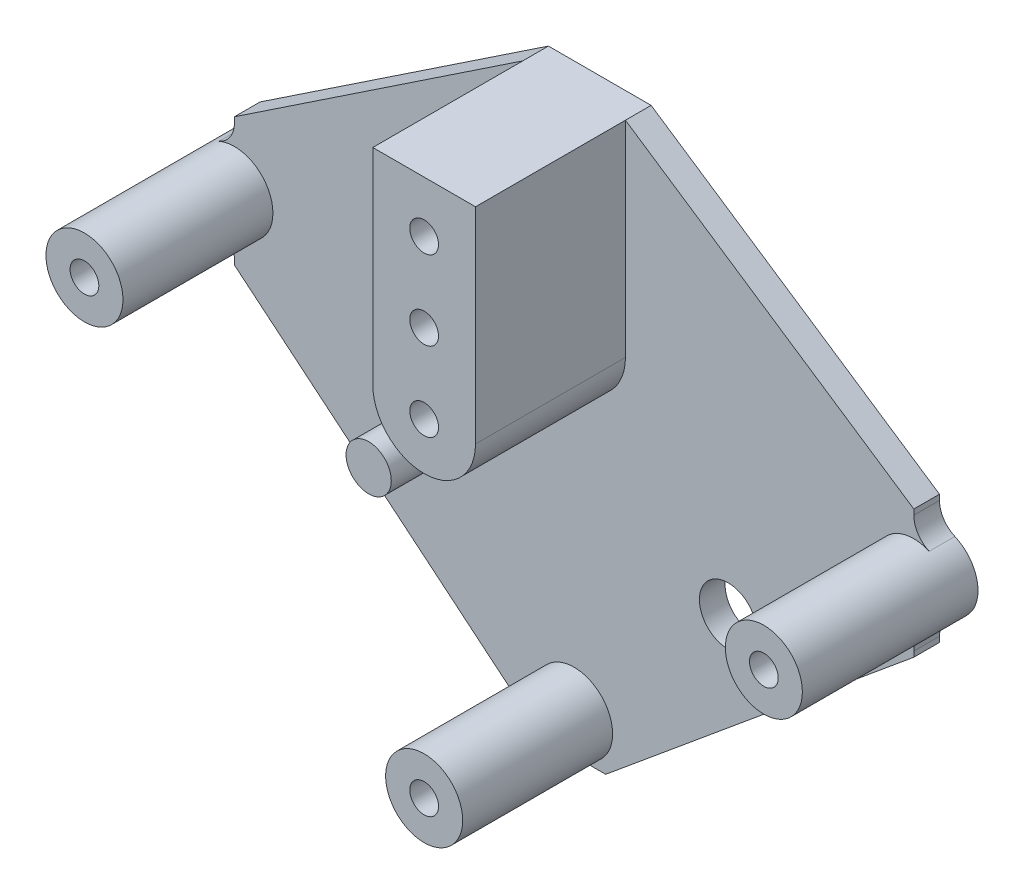
from build123d import *

# Parameters (mm, degrees)
SKETCH1_W               = 84.00796
SKETCH1_H               = 71.2724
BOSS_EXTRUDE1_DEPTH     = 3.175
SKETCH5_R               = 4.7625
BOSS_EXTRUDE3_DEPTH     = 3.175
SKETCH3_R               = 1.8415
CUT_EXTRUDE1_DEPTH      = 114.886040389
BOSS_EXTRUDE4_START     = 18.542
SKETCH6_R               = 4.7625
BOSS_EXTRUDE4_DEPTH     = 18.542
CUT_EXTRUDE2_DEPTH      = 116.341906237
CUT_EXTRUDE2_DEPTH_BACK = 116.341906237
SKETCH4_R               = 1.778
SKETCH7_R               = 1.778
CUT_EXTRUDE3_DEPTH      = 116.894683482
SKETCH8_R               = 3.556
SKETCH8_R_2             = 1.905
CUT_EXTRUDE4_DEPTH      = 116.894683482
CUT_EXTRUDE5_DEPTH      = 116.894683482
FILLET1_R               = 3.175
SKETCH10_R              = 2.794
BOSS_EXTRUDE5_DEPTH     = 6.35
BOSS_EXTRUDE6_START     = 3.175
SKETCH11_R              = 1.905
BOSS_EXTRUDE6_DEPTH     = 3.175


with BuildPart() as part:
    # Sketch1 → Boss-Extrude1 (new body)
    with BuildSketch(Plane.XY):
        with Locations((42.00398, 35.6362)):
            Rectangle(SKETCH1_W, SKETCH1_H)
    extrude(amount=BOSS_EXTRUDE1_DEPTH)

    # Sketch5 → Boss-Extrude3 (add)
    with BuildSketch(Plane.XY.offset(3.175)):
        with Locations((84.00796, 39.524999944)):
            Circle(SKETCH5_R)
        with Locations((0, 39.524999944)):
            Circle(SKETCH5_R)
    extrude(amount=-BOSS_EXTRUDE3_DEPTH)

    # Sketch3 → Cut-Extrude1 (cut, through all)
    with BuildSketch(Plane.XY.offset(3.175)):
        with Locations((42.00398, 4.7625)):
            Circle(SKETCH3_R)
    extrude(amount=-CUT_EXTRUDE1_DEPTH, mode=Mode.SUBTRACT)

    # Sketch6 → Boss-Extrude4 (add)
    with BuildSketch(Plane.XY.offset(3.175).offset(BOSS_EXTRUDE4_START)):
        with Locations((84.00796, 39.524999944)):
            Circle(SKETCH6_R)
        with Locations((0, 39.524999944)):
            Circle(SKETCH6_R)
        with Locations(Location((42.00398, 4.7625, 0), (0, 0, 270))):
            Circle(SKETCH6_R)
        with BuildLine():
            Line((35.65398, 71.2724), (48.35398, 71.2724))
            Line((48.35398, 71.2724), (48.35398, 45.8724))
            ThreePointArc((48.35398, 45.8724), (42.00398, 39.5224), (35.65398, 45.8724))
            Line((35.65398, 45.8724), (35.65398, 71.2724))
        make_face()
    extrude(amount=-BOSS_EXTRUDE4_DEPTH)

    # Sketch4 → Cut-Extrude2 (cut, two sides: drawn at the far end of the back side and taken through both)
    with BuildSketch(Plane.XY.offset(3.175).offset(-CUT_EXTRUDE2_DEPTH_BACK)):
        with Locations((42.00398, 64.9224)):
            Circle(SKETCH4_R)
        with Locations((42.00398, 55.1434)):
            Circle(SKETCH4_R)
        with Locations((42.00398, 45.3644)):
            Circle(SKETCH4_R)
    extrude(amount=CUT_EXTRUDE2_DEPTH + CUT_EXTRUDE2_DEPTH_BACK, mode=Mode.SUBTRACT)

    # Sketch7 → Cut-Extrude3 (cut, through all)
    with BuildSketch(Plane(origin=(0, 0, 0), x_dir=(-1, 0, 0), z_dir=(0, 0, -1))):
        with Locations((-42.00398, 4.7625)):
            Circle(SKETCH7_R)
        with Locations((0, 39.524999944)):
            Circle(SKETCH7_R)
        with Locations((-84.00796, 39.524999944)):
            Circle(SKETCH7_R)
    extrude(amount=-CUT_EXTRUDE3_DEPTH, mode=Mode.SUBTRACT)

    # Sketch8 → Cut-Extrude4 (cut, through all)
    with BuildSketch(Plane(origin=(0, 0, 0), x_dir=(-1, 0, 0), z_dir=(0, 0, -1))):
        with Locations((-61.05398, 24.524999972)):
            Circle(SKETCH8_R)
        with Locations((-22.95398, 24.524999972)):
            Circle(SKETCH8_R_2)
    extrude(amount=-CUT_EXTRUDE4_DEPTH, mode=Mode.SUBTRACT)

    # Sketch9 → Cut-Extrude5 (cut, through all)
    with BuildSketch(Plane(origin=(0, 0, 0), x_dir=(-1, 0, 0), z_dir=(0, 0, -1))):
        Polygon((-84.00796, 0), (-84.00796, 31.587499944), (-45.90796, 0), align=None)
        Polygon((-84.00796, 71.2724), (-84.00796, 47.462499944), (-48.35398, 71.2724), align=None)
    cut_extrude5 = extrude(amount=-CUT_EXTRUDE5_DEPTH, mode=Mode.SUBTRACT)

    # Mirror1: Cut-Extrude5 across plane
    add(cut_extrude5.mirror(Plane(origin=(42.00398, 0, 0), x_dir=(0, 0, 1), z_dir=(1, 0, 0))), mode=Mode.SUBTRACT)

    # Fillet1
    # the kernel refuses this fillet: 3.175 mm, written as the material it adds along each edge
    with BuildSketch(Plane(origin=(84.00796, 34.762499944, 0), x_dir=(0.9789063129307042, 0.2043096436892158, 0), z_dir=(0, 0, 1))) as fillet1_piece_1:
        with BuildLine():
            CenterArc((2.594732475, -3.108027544), FILLET1_R, 101.789089239, 66.421821522)
            Line((-0.513295069, -2.459344425), (0, 0))
            ThreePointArc((0, 0), (0.973024678, -0.100458685), (1.946049356, 0))
        make_face()
    extrude(amount=3.175)
    with BuildSketch(Plane(origin=(84.00796, 44.287499944, 0), x_dir=(0, 1, 0), z_dir=(0, 0, 1)), Plane(origin=(0, 34.762499944, 0), x_dir=(0, -1, 0), z_dir=(0, 0, 1))) as fillet1_piece_2:
        with BuildLine():
            CenterArc((2.512338916, -3.175), FILLET1_R, 90, 66.421821522)
            ThreePointArc((-0.397596651, -1.905), (-0.100458685, -0.973024678), (0, 0))
            Line((0, 0), (2.512338916, 0))
        make_face()
    extrude(amount=3.175)
    with BuildSketch(Plane(origin=(0, 44.287499944, 0), x_dir=(0, 1, 0), z_dir=(0, 0, 1))) as fillet1_piece_3:
        with BuildLine():
            CenterArc((2.512338916, 3.175), FILLET1_R, 203.578178478, 66.421821522)
            ThreePointArc((-0.397596651, 1.905), (-0.100458685, 0.973024678), (0, 0))
            Line((0, 0), (2.512338916, 0))
        make_face()
    extrude(amount=3.175)

    # Sketch10 → Boss-Extrude5 (add)
    with BuildSketch(Plane.XY.offset(3.175)):
        with Locations(Location((22.95398, 24.524999972, 0), (0, 0, 180))):
            Circle(SKETCH10_R)
    extrude(amount=BOSS_EXTRUDE5_DEPTH)

    # Sketch11 → Boss-Extrude6 (add)
    with BuildSketch(Plane(origin=(0, 0, 3.175), x_dir=(-1, 0, 0), z_dir=(0, 0, -1)).offset(BOSS_EXTRUDE6_START)):
        with Locations((-22.95398, 24.524999972)):
            Circle(SKETCH11_R)
    extrude(amount=-BOSS_EXTRUDE6_DEPTH)


solid = part.part
